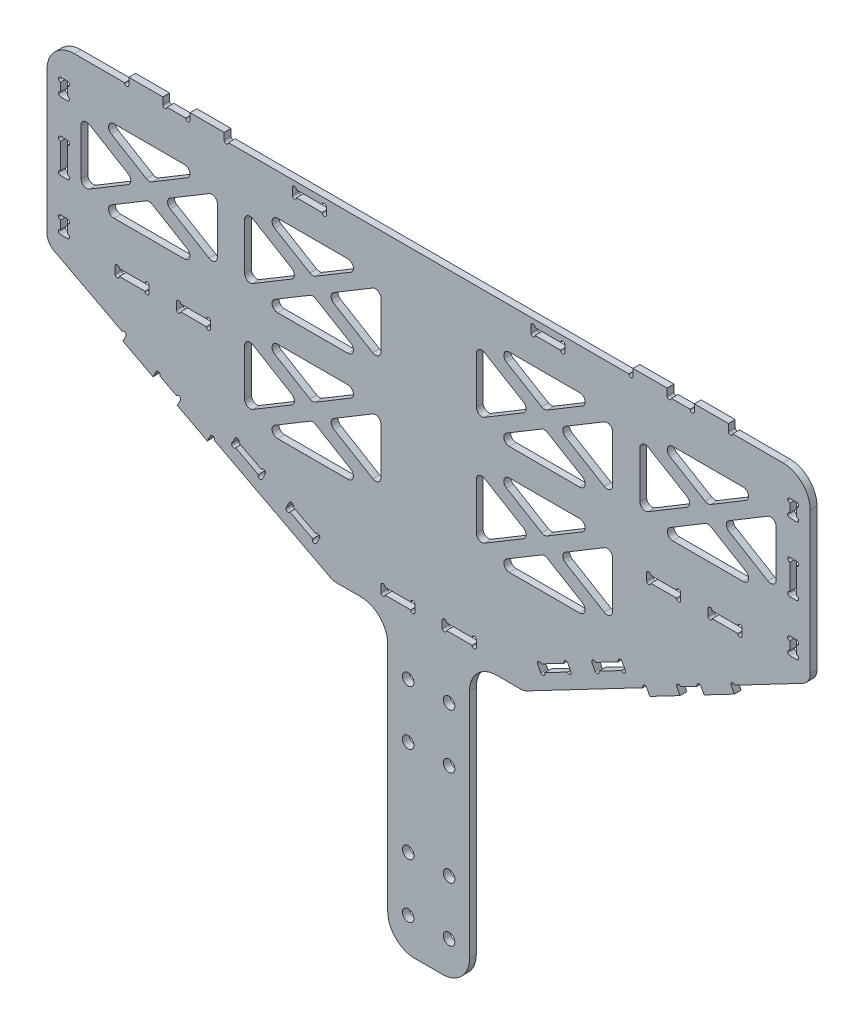
from build123d import *

# Parameters (mm, degrees)
EXTRUDE_1_DEPTH                = 5
SKETCH_2_R                     = 4.25
CUT_EXTRUDE_1_DEPTH            = 26
FILLET_1_R                     = 20
SKETCH_3_W                     = 61.624102005
SKETCH_3_H                     = 24.649640802
EXTRUDE_2_DEPTH                = 5
CUT_EXTRUDE_6_DEPTH            = 5
FILLET_2_R                     = 4
PATTERN_LINEAR_1_COUNT         = 2
PATTERN_LINEAR_1_PITCH         = 120
PATTERN_LINEAR_1_COUNT_DIR2    = 2
PATTERN_LINEAR_1_PITCH_DIR2    = 80
FILLET_2_OF_PATTERN_LINEAR_1_R = 4
MIRROR_1_DEPTH                 = 5
CUT_EXTRUDE_7_DEPTH            = 10
CUT_EXTRUDE_8_DEPTH            = 10
FILLET_3_R                     = 10
SKETCH_11_W                    = 25
SKETCH_11_H                    = 5
CUT_EXTRUDE_9_DEPTH            = 10
SKETCH_12_R                    = 1.55
CUT_EXTRUDE_10_DEPTH           = 10
SKETCH_13_W                    = 5
SKETCH_13_H                    = 12.5
SKETCH_13_H_2                  = 25
CUT_EXTRUDE_11_DEPTH           = 10
SKETCH_14_R                    = 1.55
CUT_EXTRUDE_12_DEPTH           = 10
CUT_EXTRUDE_13_DEPTH           = 10
SKETCH_16_W                    = 25
SKETCH_16_H                    = 5
EXTRUDE_3_DEPTH                = 5
SKETCH_17_R                    = 1.55
CUT_EXTRUDE_14_DEPTH           = 5
EXTRUDE_4_DEPTH                = 5
SKETCH_19_R                    = 1.55
CUT_EXTRUDE_15_DEPTH           = 5


# Read off the part's stored shape, not the designer's step: 镜向1
with BuildPart() as part:
    # 草图1 → 凸台-拉伸1 (new body)
    with BuildSketch(Plane.XY):
        Polygon((-30, 0), (30, 0), (30, 210), (280, 210), (280, 450), (-280, 450), (-280, 210), (-30, 210), align=None)
    extrude(amount=EXTRUDE_1_DEPTH)

    # 草图2 → 切除-拉伸1 (cut)
    with BuildSketch(Plane.XY.offset(5)):
        with Locations((15, 25)):
            Circle(SKETCH_2_R)
        with Locations((15, 65)):
            Circle(SKETCH_2_R)
        with Locations((15, 135)):
            Circle(SKETCH_2_R)
        with Locations((15, 175)):
            Circle(SKETCH_2_R)
        with Locations(Location((-15, 175, 0), (0, 0, 180))):
            Circle(SKETCH_2_R)
        with Locations(Location((-15, 135, 0), (0, 0, 180))):
            Circle(SKETCH_2_R)
        with Locations(Location((-15, 65, 0), (0, 0, 180))):
            Circle(SKETCH_2_R)
        with Locations(Location((-15, 25, 0), (0, 0, 180))):
            Circle(SKETCH_2_R)
    extrude(amount=-CUT_EXTRUDE_1_DEPTH, mode=Mode.SUBTRACT)

    # 圆角1
    fillet_1_edges = [part.edges().sort_by_distance(p)[0] for p in [
        (30, 0, 2.5),
        (-30, 0, 2.5),
        (-30, 210, 2.5),
        (-280, 210, 2.5),
        (-280, 450, 2.5),
        (280, 450, 2.5),
        (280, 210, 2.5),
        (30, 210, 2.5),
    ]]
    fillet(fillet_1_edges, radius=FILLET_1_R)

    # 草图3 → 凸台-拉伸2 (add)
    with BuildSketch(Plane.XY.offset(5)):
        with Locations((-121.322450822, 379.637980968)):
            Rectangle(SKETCH_3_W, SKETCH_3_H)
    extrude(amount=-EXTRUDE_2_DEPTH)

    # 草图8 → 切除-拉伸6 (cut)
    with BuildSketch(Plane(origin=(0, 0, 0), x_dir=(-1, 0, 0), z_dir=(0, 0, -1))):
        Polygon((-245.281746842, 420), (-164.718253158, 420), (-205, 395.830951895), align=None)
        Polygon((-255, 414.169048105), (-255, 365.830951895), (-214.718253158, 390), align=None)
        Polygon((-245.281746842, 360), (-164.718253158, 360), (-205, 384.169048105), align=None)
        Polygon((-155, 414.169048105), (-155, 365.830951895), (-195.281746842, 390), align=None)
    cut_extrude_6 = extrude(amount=-CUT_EXTRUDE_6_DEPTH, mode=Mode.SUBTRACT)

    # 圆角2
    fillet_2_edges = [part.edges().sort_by_distance(p)[0] for p in [
        (255, 414.169048105, 2.5),
        (214.718253158, 390, 2.5),
        (255, 365.830951895, 2.5),
        (195.281746842, 390, 2.5),
        (155, 414.169048105, 2.5),
        (155, 365.830951895, 2.5),
        (205, 384.169048105, 2.5),
        (164.718253158, 360, 2.5),
        (245.281746842, 360, 2.5),
        (205, 395.830951895, 2.5),
        (245.281746842, 420, 2.5),
        (164.718253158, 420, 2.5),
    ]]
    fillet(fillet_2_edges, radius=FILLET_2_R)

    # 阵列(线性)1: Cut-Extrude 6 2 × 2, 1 skipped
    with Locations(*[(-i * PATTERN_LINEAR_1_PITCH, -j * PATTERN_LINEAR_1_PITCH_DIR2, 0) for i in range(PATTERN_LINEAR_1_COUNT) for j in range(PATTERN_LINEAR_1_COUNT_DIR2) if (i, j) not in ((0, 0), (0, 1))]):
        add(cut_extrude_6, mode=Mode.SUBTRACT)

    # 圆角2 of 阵列(线性)1
    fillet_2_of_pattern_linear_1_edges = [part.edges().sort_by_distance(p)[0] for p in [
        (135, 414.169048105, 2.5),
        (94.718253158, 390, 2.5),
        (135, 365.830951895, 2.5),
        (75.281746842, 390, 2.5),
        (35, 414.169048105, 2.5),
        (35, 365.830951895, 2.5),
        (85, 384.169048105, 2.5),
        (44.718253158, 360, 2.5),
        (125.281746842, 360, 2.5),
        (85, 395.830951895, 2.5),
        (125.281746842, 420, 2.5),
        (44.718253158, 420, 2.5),
        (135, 334.169048105, 2.5),
        (94.718253158, 310, 2.5),
        (135, 285.830951895, 2.5),
        (75.281746842, 310, 2.5),
        (35, 334.169048105, 2.5),
        (35, 285.830951895, 2.5),
        (85, 304.169048105, 2.5),
        (44.718253158, 280, 2.5),
        (125.281746842, 280, 2.5),
        (85, 315.830951895, 2.5),
        (125.281746842, 340, 2.5),
        (44.718253158, 340, 2.5),
    ]]
    fillet(fillet_2_of_pattern_linear_1_edges, radius=FILLET_2_OF_PATTERN_LINEAR_1_R)

    # 镜向1 outline → 镜向1 (cut)
    with BuildSketch(Plane.XY):
        with BuildLine():
            Line((-110.840477649, 280), (-59.159522351, 280))
            ThreePointArc((-59.159522351, 280), (-55.304662638, 282.932265672), (-57.101539329, 287.429971703))
            Line((-57.101539329, 287.429971703), (-82.942016978, 302.934258292))
            ThreePointArc((-82.942016978, 302.934258292), (-85, 303.504286589), (-87.057983022, 302.934258292))
            Line((-87.057983022, 302.934258292), (-112.898460671, 287.429971703))
            ThreePointArc((-112.898460671, 287.429971703), (-114.695337362, 282.932265672), (-110.840477649, 280))
        make_face()
        with BuildLine():
            Line((-59.159522351, 340), (-110.840477649, 340))
            ThreePointArc((-110.840477649, 340), (-114.695337362, 337.067734328), (-112.898460671, 332.570028297))
            Line((-112.898460671, 332.570028297), (-87.057983022, 317.065741708))
            ThreePointArc((-87.057983022, 317.065741708), (-85, 316.495713411), (-82.942016978, 317.065741708))
            Line((-82.942016978, 317.065741708), (-57.101539329, 332.570028297))
            ThreePointArc((-57.101539329, 332.570028297), (-55.304662638, 337.067734328), (-59.159522351, 340))
        make_face()
        with BuildLine():
            Line((-179.159522351, 420), (-230.840477649, 420))
            ThreePointArc((-230.840477649, 420), (-234.695337362, 417.067734328), (-232.898460671, 412.570028297))
            Line((-232.898460671, 412.570028297), (-207.057983022, 397.065741708))
            ThreePointArc((-207.057983022, 397.065741708), (-205, 396.495713411), (-202.942016978, 397.065741708))
            Line((-202.942016978, 397.065741708), (-177.101539329, 412.570028297))
            ThreePointArc((-177.101539329, 412.570028297), (-175.304662638, 417.067734328), (-179.159522351, 420))
        make_face()
        with BuildLine():
            Line((-59.159522351, 420), (-110.840477649, 420))
            ThreePointArc((-110.840477649, 420), (-114.695337362, 417.067734328), (-112.898460671, 412.570028297))
            Line((-112.898460671, 412.570028297), (-87.057983022, 397.065741708))
            ThreePointArc((-87.057983022, 397.065741708), (-85, 396.495713411), (-82.942016978, 397.065741708))
            Line((-82.942016978, 397.065741708), (-57.101539329, 412.570028297))
            ThreePointArc((-57.101539329, 412.570028297), (-55.304662638, 417.067734328), (-59.159522351, 420))
        make_face()
        with BuildLine():
            Line((-230.840477649, 360), (-179.159522351, 360))
            ThreePointArc((-179.159522351, 360), (-175.304662638, 362.932265672), (-177.101539329, 367.429971703))
            Line((-177.101539329, 367.429971703), (-202.942016978, 382.934258292))
            ThreePointArc((-202.942016978, 382.934258292), (-205, 383.504286589), (-207.057983022, 382.934258292))
            Line((-207.057983022, 382.934258292), (-232.898460671, 367.429971703))
            ThreePointArc((-232.898460671, 367.429971703), (-234.695337362, 362.932265672), (-230.840477649, 360))
        make_face()
        with BuildLine():
            Line((-110.840477649, 360), (-59.159522351, 360))
            ThreePointArc((-59.159522351, 360), (-55.304662638, 362.932265672), (-57.101539329, 367.429971703))
            Line((-57.101539329, 367.429971703), (-82.942016978, 382.934258292))
            ThreePointArc((-82.942016978, 382.934258292), (-85, 383.504286589), (-87.057983022, 382.934258292))
            Line((-87.057983022, 382.934258292), (-112.898460671, 367.429971703))
            ThreePointArc((-112.898460671, 367.429971703), (-114.695337362, 362.932265672), (-110.840477649, 360))
        make_face()
        with BuildLine():
            Line((-248.942016978, 369.465741708), (-220.434872663, 386.570028297))
            ThreePointArc((-220.434872663, 386.570028297), (-218.492855685, 390), (-220.434872663, 393.429971703))
            Line((-220.434872663, 393.429971703), (-248.942016978, 410.534258292))
            ThreePointArc((-248.942016978, 410.534258292), (-252.97079526, 410.585086216), (-255, 407.104286589))
            Line((-255, 407.104286589), (-255, 372.895713411))
            ThreePointArc((-255, 372.895713411), (-252.97079526, 369.414913784), (-248.942016978, 369.465741708))
        make_face()
        with BuildLine():
            Line((-189.565127337, 386.570028297), (-161.057983022, 369.465741708))
            ThreePointArc((-161.057983022, 369.465741708), (-157.02920474, 369.414913784), (-155, 372.895713411))
            Line((-155, 372.895713411), (-155, 407.104286589))
            ThreePointArc((-155, 407.104286589), (-157.02920474, 410.585086216), (-161.057983022, 410.534258292))
            Line((-161.057983022, 410.534258292), (-189.565127337, 393.429971703))
            ThreePointArc((-189.565127337, 393.429971703), (-191.507144315, 390), (-189.565127337, 386.570028297))
        make_face()
        with BuildLine():
            Line((-128.942016978, 289.465741708), (-100.434872663, 306.570028297))
            ThreePointArc((-100.434872663, 306.570028297), (-98.492855685, 310), (-100.434872663, 313.429971703))
            Line((-100.434872663, 313.429971703), (-128.942016978, 330.534258292))
            ThreePointArc((-128.942016978, 330.534258292), (-132.97079526, 330.585086216), (-135, 327.104286589))
            Line((-135, 327.104286589), (-135, 292.895713411))
            ThreePointArc((-135, 292.895713411), (-132.97079526, 289.414913784), (-128.942016978, 289.465741708))
        make_face()
        with BuildLine():
            Line((-135, 407.104286589), (-135, 372.895713411))
            ThreePointArc((-135, 372.895713411), (-132.97079526, 369.414913784), (-128.942016978, 369.465741708))
            Line((-128.942016978, 369.465741708), (-100.434872663, 386.570028297))
            ThreePointArc((-100.434872663, 386.570028297), (-98.492855685, 390), (-100.434872663, 393.429971703))
            Line((-100.434872663, 393.429971703), (-128.942016978, 410.534258292))
            ThreePointArc((-128.942016978, 410.534258292), (-132.97079526, 410.585086216), (-135, 407.104286589))
        make_face()
        with BuildLine():
            Line((-35, 292.895713411), (-35, 327.104286589))
            ThreePointArc((-35, 327.104286589), (-37.02920474, 330.585086216), (-41.057983022, 330.534258292))
            Line((-41.057983022, 330.534258292), (-69.565127337, 313.429971703))
            ThreePointArc((-69.565127337, 313.429971703), (-71.507144315, 310), (-69.565127337, 306.570028297))
            Line((-69.565127337, 306.570028297), (-41.057983022, 289.465741708))
            ThreePointArc((-41.057983022, 289.465741708), (-37.02920474, 289.414913784), (-35, 292.895713411))
        make_face()
        with BuildLine():
            Line((-35, 372.895713411), (-35, 407.104286589))
            ThreePointArc((-35, 407.104286589), (-37.02920474, 410.585086216), (-41.057983022, 410.534258292))
            Line((-41.057983022, 410.534258292), (-69.565127337, 393.429971703))
            ThreePointArc((-69.565127337, 393.429971703), (-71.507144315, 390), (-69.565127337, 386.570028297))
            Line((-69.565127337, 386.570028297), (-41.057983022, 369.465741708))
            ThreePointArc((-41.057983022, 369.465741708), (-37.02920474, 369.414913784), (-35, 372.895713411))
        make_face()
    extrude(amount=MIRROR_1_DEPTH, mode=Mode.SUBTRACT)

    # 草图9 → 切除-拉伸7 (cut)
    with BuildSketch(Plane(origin=(0, 0, 0), x_dir=(-1, 0, 0), z_dir=(0, 0, -1))):
        with BuildLine():
            Line((78.1, 445), (96.9, 445))
            ThreePointArc((96.9, 445), (98.45, 446.55), (100, 445))
            Line((100, 445), (100, 440))
            ThreePointArc((100, 440), (98.45, 438.45), (96.9, 440))
            Line((96.9, 440), (78.1, 440))
            ThreePointArc((78.1, 440), (76.55, 438.45), (75, 440))
            Line((75, 440), (75, 445))
            ThreePointArc((75, 445), (76.55, 446.55), (78.1, 445))
        make_face()
        with BuildLine():
            Line((-100, 445), (-100, 440))
            ThreePointArc((-100, 440), (-98.45, 438.45), (-96.9, 440))
            Line((-96.9, 440), (-78.1, 440))
            ThreePointArc((-78.1, 440), (-76.55, 438.45), (-75, 440))
            Line((-75, 440), (-75, 445))
            ThreePointArc((-75, 445), (-76.55, 446.55), (-78.1, 445))
            Line((-78.1, 445), (-96.9, 445))
            ThreePointArc((-96.9, 445), (-98.45, 446.55), (-100, 445))
        make_face()
    extrude(amount=-CUT_EXTRUDE_7_DEPTH, mode=Mode.SUBTRACT)

    # 草图10 → 切除-拉伸8 (cut)
    with BuildSketch(Plane.XY.offset(5)):
        with BuildLine():
            Line((280, 320), (70, 210))
            Line((70, 210), (260, 210))
            ThreePointArc((260, 210), (274.142135624, 215.857864376), (280, 230))
            Line((280, 230), (280, 320))
        make_face()
        with BuildLine():
            Line((-280, 320), (-70, 210))
            Line((-70, 210), (-260, 210))
            ThreePointArc((-260, 210), (-274.142135624, 215.857864376), (-280, 230))
            Line((-280, 230), (-280, 320))
        make_face()
    extrude(amount=-CUT_EXTRUDE_8_DEPTH, mode=Mode.SUBTRACT)

    # 圆角3
    fillet_3_edges = [part.edges().sort_by_distance(p)[0] for p in [
        (280, 320, 2.5),
        (70, 210, 2.5),
        (-280, 320, 2.5),
        (-70, 210, 2.5),
    ]]
    fillet(fillet_3_edges, radius=FILLET_3_R)

    # 草图11 → 切除-拉伸9 (cut)
    with BuildSketch(Plane.XY.offset(5)):
        with Locations((172.5, 327.5)):
            Rectangle(SKETCH_11_W, SKETCH_11_H)
        with Locations((217.5, 327.5)):
            Rectangle(SKETCH_11_W, SKETCH_11_H)
        with Locations((-217.5, 327.5)):
            Rectangle(SKETCH_11_W, SKETCH_11_H)
        with Locations((-172.5, 327.5)):
            Rectangle(SKETCH_11_W, SKETCH_11_H)
    extrude(amount=-CUT_EXTRUDE_9_DEPTH, mode=Mode.SUBTRACT)

    # 草图12 → 切除-拉伸10 (cut)
    with BuildSketch(Plane.XY.offset(5)):
        with Locations((228.45, 330)):
            Circle(SKETCH_12_R)
        with Locations((206.55, 330)):
            Circle(SKETCH_12_R)
        with Locations((228.45, 325)):
            Circle(SKETCH_12_R)
        with Locations((206.55, 325)):
            Circle(SKETCH_12_R)
        with Locations((183.45, 330)):
            Circle(SKETCH_12_R)
        with Locations((161.55, 330)):
            Circle(SKETCH_12_R)
        with Locations((161.55, 325)):
            Circle(SKETCH_12_R)
        with Locations((183.45, 325)):
            Circle(SKETCH_12_R)
        with Locations((-183.45, 325)):
            Circle(SKETCH_12_R)
        with Locations((-161.55, 325)):
            Circle(SKETCH_12_R)
        with Locations((-161.55, 330)):
            Circle(SKETCH_12_R)
        with Locations((-183.45, 330)):
            Circle(SKETCH_12_R)
        with Locations((-206.55, 325)):
            Circle(SKETCH_12_R)
        with Locations((-228.45, 325)):
            Circle(SKETCH_12_R)
        with Locations((-206.55, 330)):
            Circle(SKETCH_12_R)
        with Locations((-228.45, 330)):
            Circle(SKETCH_12_R)
    extrude(amount=-CUT_EXTRUDE_10_DEPTH, mode=Mode.SUBTRACT)

    # 草图13 → 切除-拉伸11 (cut)
    with BuildSketch(Plane(origin=(0, 0, 0), x_dir=(-1, 0, 0), z_dir=(0, 0, -1))):
        with Locations((-267.5, 423.75)):
            Rectangle(SKETCH_13_W, SKETCH_13_H)
        with Locations((-267.5, 380)):
            Rectangle(SKETCH_13_W, SKETCH_13_H_2)
        with Locations((-267.5, 336.25)):
            Rectangle(SKETCH_13_W, SKETCH_13_H)
        with Locations((267.5, 336.25)):
            Rectangle(SKETCH_13_W, SKETCH_13_H)
        with Locations((267.5, 380)):
            Rectangle(SKETCH_13_W, SKETCH_13_H_2)
        with Locations((267.5, 423.75)):
            Rectangle(SKETCH_13_W, SKETCH_13_H)
    extrude(amount=-CUT_EXTRUDE_11_DEPTH, mode=Mode.SUBTRACT)

    # 草图14 → 切除-拉伸12 (cut)
    with BuildSketch(Plane(origin=(0, 0, 0), x_dir=(-1, 0, 0), z_dir=(0, 0, -1))):
        with Locations((-265, 428.45)):
            Circle(SKETCH_14_R)
        with Locations((-265, 419.05)):
            Circle(SKETCH_14_R)
        with Locations((-270, 428.45)):
            Circle(SKETCH_14_R)
        with Locations((-270, 419.05)):
            Circle(SKETCH_14_R)
        with Locations((-265, 390.95)):
            Circle(SKETCH_14_R)
        with Locations((-270, 390.95)):
            Circle(SKETCH_14_R)
        with Locations((-265, 369.05)):
            Circle(SKETCH_14_R)
        with Locations((-270, 369.05)):
            Circle(SKETCH_14_R)
        with Locations((-265, 340.95)):
            Circle(SKETCH_14_R)
        with Locations((-270, 340.95)):
            Circle(SKETCH_14_R)
        with Locations((-265, 331.55)):
            Circle(SKETCH_14_R)
        with Locations((-270, 331.55)):
            Circle(SKETCH_14_R)
        with Locations((270, 331.55)):
            Circle(SKETCH_14_R)
        with Locations((265, 331.55)):
            Circle(SKETCH_14_R)
        with Locations((270, 340.95)):
            Circle(SKETCH_14_R)
        with Locations((265, 340.95)):
            Circle(SKETCH_14_R)
        with Locations((270, 369.05)):
            Circle(SKETCH_14_R)
        with Locations((265, 369.05)):
            Circle(SKETCH_14_R)
        with Locations((270, 390.95)):
            Circle(SKETCH_14_R)
        with Locations((265, 390.95)):
            Circle(SKETCH_14_R)
        with Locations((270, 419.05)):
            Circle(SKETCH_14_R)
        with Locations((270, 428.45)):
            Circle(SKETCH_14_R)
        with Locations((265, 419.05)):
            Circle(SKETCH_14_R)
        with Locations((265, 428.45)):
            Circle(SKETCH_14_R)
    extrude(amount=-CUT_EXTRUDE_12_DEPTH, mode=Mode.SUBTRACT)

    # 草图15 → 切除-拉伸13 (cut)
    with BuildSketch(Plane.XY.offset(5)):
        with BuildLine():
            Line((-139.26212971, 263.213405455), (-122.608496847, 254.490073955))
            ThreePointArc((-122.608496847, 254.490073955), (-120.516247126, 255.143901993), (-119.862419088, 253.051652271))
            Line((-119.862419088, 253.051652271), (-122.182454061, 248.622494595))
            ThreePointArc((-122.182454061, 248.622494595), (-124.274703782, 247.968666557), (-124.92853182, 250.060916278))
            Line((-124.92853182, 250.060916278), (-141.582164684, 258.784247778))
            ThreePointArc((-141.582164684, 258.784247778), (-143.674414405, 258.13041974), (-144.328242443, 260.222669462))
            Line((-144.328242443, 260.222669462), (-142.00820747, 264.651827138))
            ThreePointArc((-142.00820747, 264.651827138), (-139.915957748, 265.305655176), (-139.26212971, 263.213405455))
        make_face()
        with BuildLine():
            Line((-102.145788382, 243.771512378), (-104.465823355, 239.342354702))
            ThreePointArc((-104.465823355, 239.342354702), (-103.811995317, 237.25010498), (-101.719745596, 237.903933018))
            Line((-101.719745596, 237.903933018), (-85.066112733, 229.180601518))
            ThreePointArc((-85.066112733, 229.180601518), (-84.412284695, 227.088351797), (-82.320034973, 227.742179835))
            Line((-82.320034973, 227.742179835), (-80, 232.171337511))
            ThreePointArc((-80, 232.171337511), (-80.653828038, 234.263587233), (-82.746077759, 233.609759195))
            Line((-82.746077759, 233.609759195), (-99.399710623, 242.333090694))
            ThreePointArc((-99.399710623, 242.333090694), (-100.053538661, 244.425340416), (-102.145788382, 243.771512378))
        make_face()
        with BuildLine():
            Line((10, 225), (10, 220))
            ThreePointArc((10, 220), (11.55, 218.45), (13.1, 220))
            Line((13.1, 220), (31.9, 220))
            ThreePointArc((31.9, 220), (33.45, 218.45), (35, 220))
            Line((35, 220), (35, 225))
            ThreePointArc((35, 225), (33.45, 226.55), (31.9, 225))
            Line((31.9, 225), (13.1, 225))
            ThreePointArc((13.1, 225), (11.55, 226.55), (10, 225))
        make_face()
        with BuildLine():
            Line((-31.9, 225), (-13.1, 225))
            ThreePointArc((-13.1, 225), (-11.55, 226.55), (-10, 225))
            Line((-10, 225), (-10, 220))
            ThreePointArc((-10, 220), (-11.55, 218.45), (-13.1, 220))
            Line((-13.1, 220), (-31.9, 220))
            ThreePointArc((-31.9, 220), (-33.45, 218.45), (-35, 220))
            Line((-35, 220), (-35, 225))
            ThreePointArc((-35, 225), (-33.45, 226.55), (-31.9, 225))
        make_face()
        with BuildLine():
            Line((82.746077759, 233.609759195), (99.399710623, 242.333090694))
            ThreePointArc((99.399710623, 242.333090694), (100.053538661, 244.425340416), (102.145788382, 243.771512378))
            Line((102.145788382, 243.771512378), (104.465823355, 239.342354702))
            ThreePointArc((104.465823355, 239.342354702), (103.811995317, 237.25010498), (101.719745596, 237.903933018))
            Line((101.719745596, 237.903933018), (85.066112733, 229.180601518))
            ThreePointArc((85.066112733, 229.180601518), (84.412284695, 227.088351797), (82.320034973, 227.742179835))
            Line((82.320034973, 227.742179835), (80, 232.171337511))
            ThreePointArc((80, 232.171337511), (80.653828038, 234.263587233), (82.746077759, 233.609759195))
        make_face()
        with BuildLine():
            Line((144.328242443, 260.222669462), (142.00820747, 264.651827138))
            ThreePointArc((142.00820747, 264.651827138), (139.915957748, 265.305655176), (139.26212971, 263.213405455))
            Line((139.26212971, 263.213405455), (122.608496847, 254.490073955))
            ThreePointArc((122.608496847, 254.490073955), (120.516247126, 255.143901993), (119.862419088, 253.051652271))
            Line((119.862419088, 253.051652271), (122.182454061, 248.622494595))
            ThreePointArc((122.182454061, 248.622494595), (124.274703782, 247.968666557), (124.92853182, 250.060916278))
            Line((124.92853182, 250.060916278), (141.582164684, 258.784247778))
            ThreePointArc((141.582164684, 258.784247778), (143.674414405, 258.13041974), (144.328242443, 260.222669462))
        make_face()
    extrude(amount=-CUT_EXTRUDE_13_DEPTH, mode=Mode.SUBTRACT)

    # 草图16 → 凸台-拉伸3 (add)
    with BuildSketch(Plane.XY.offset(5)):
        with Locations((162.5, 452.5)):
            Rectangle(SKETCH_16_W, SKETCH_16_H)
        with Locations((-207.5, 452.5)):
            Rectangle(SKETCH_16_W, SKETCH_16_H)
        with Locations((207.5, 452.5)):
            Rectangle(SKETCH_16_W, SKETCH_16_H)
        with Locations((-162.5, 452.5)):
            Rectangle(SKETCH_16_W, SKETCH_16_H)
    extrude(amount=-EXTRUDE_3_DEPTH)

    # 草图17 → 切除-拉伸14 (cut)
    with BuildSketch(Plane.XY.offset(5)):
        with Locations((148.45, 450)):
            Circle(SKETCH_17_R)
        with Locations((176.55, 450)):
            Circle(SKETCH_17_R)
        with Locations((193.45, 450)):
            Circle(SKETCH_17_R)
        with Locations((221.55, 450)):
            Circle(SKETCH_17_R)
        with Locations((-221.55, 450)):
            Circle(SKETCH_17_R)
        with Locations((-193.45, 450)):
            Circle(SKETCH_17_R)
        with Locations((-176.55, 450)):
            Circle(SKETCH_17_R)
        with Locations((-148.45, 450)):
            Circle(SKETCH_17_R)
    extrude(amount=-CUT_EXTRUDE_14_DEPTH, mode=Mode.SUBTRACT)

    # 草图18 → 凸台-拉伸4 (add)
    with BuildSketch(Plane.XY.offset(5)):
        Polygon((160, 257.142857143), (162.320034973, 252.713699466), (184.465823355, 264.313874333), (182.145788382, 268.74303201), align=None)
        Polygon((199.862419088, 278.023171903), (202.182454061, 273.594014227), (224.328242443, 285.194189093), (222.00820747, 289.62334677), align=None)
        Polygon((-199.862419088, 278.023171903), (-222.00820747, 289.62334677), (-224.328242443, 285.194189093), (-202.182454061, 273.594014227), align=None)
        Polygon((-182.145788382, 268.74303201), (-160, 257.142857143), (-162.320034973, 252.713699466), (-184.465823355, 264.313874333), align=None)
    extrude(amount=-EXTRUDE_4_DEPTH)

    # 草图19 → 切除-拉伸15 (cut)
    with BuildSketch(Plane.XY.offset(5)):
        with Locations((183.518827262, 269.462242851)):
            Circle(SKETCH_19_R)
        with Locations((198.489380208, 277.303961061)):
            Circle(SKETCH_19_R)
        with Locations((223.381246349, 290.342557612)):
            Circle(SKETCH_19_R)
        with Locations((158.62696112, 256.423646301)):
            Circle(SKETCH_19_R)
        with Locations((-158.62696112, 256.423646301)):
            Circle(SKETCH_19_R)
        with Locations((-223.381246349, 290.342557612)):
            Circle(SKETCH_19_R)
        with Locations((-198.489380208, 277.303961061)):
            Circle(SKETCH_19_R)
        with Locations((-183.518827262, 269.462242851)):
            Circle(SKETCH_19_R)
    extrude(amount=-CUT_EXTRUDE_15_DEPTH, mode=Mode.SUBTRACT)


solid = part.part
